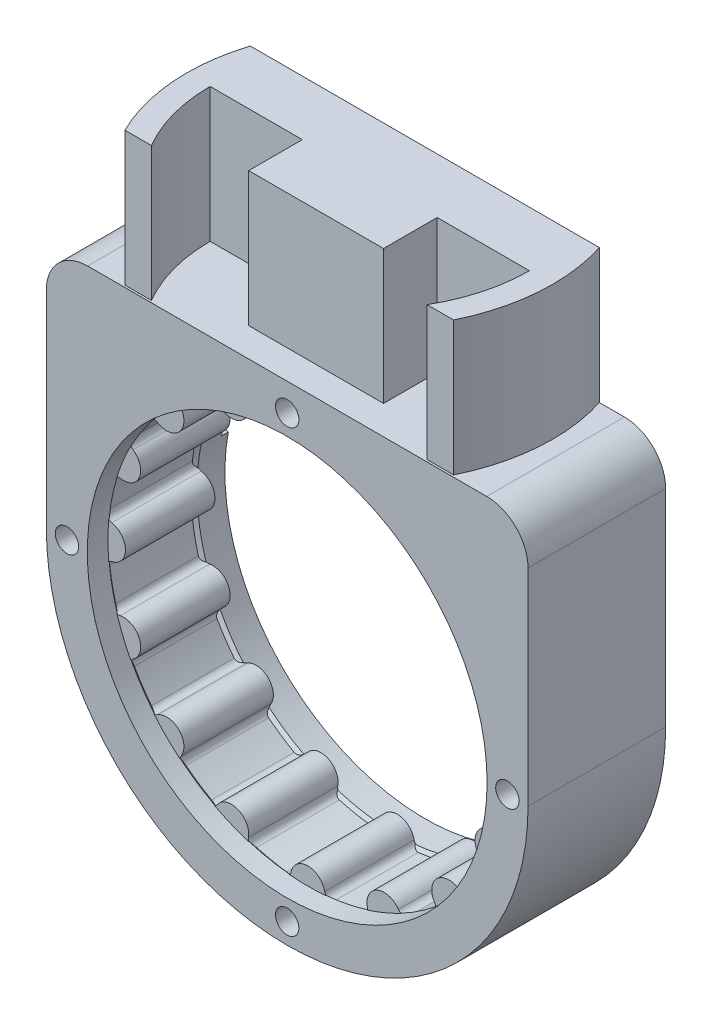
from build123d import *

# Parameters (mm, degrees)
EXTRUDE_START         = -19
EXTRUDE_2_OUTLINE_R   = 35
EXTRUDE_2_OUTLINE_R_2 = 1.7
EXTRUDE_2_DEPTH       = 20
EXTRUDE_START_2       = -16
EXTRUDE_2_2_DEPTH     = 13
EXTRUDE_START_3       = -3.0500001
EXTRUDE_2_3_DEPTH     = 4.0500001
EXTRUDE_2_4_DEPTH     = 3.049996921
EXTRUDE_2_5_DEPTH     = 3.0500001
EXTRUDE_START_4       = -20
SKETCH_8_R            = 1.7
EXTRUDE_3_DEPTH       = 20
EXTRUDE_4_DEPTH       = 19.5
FILLET_1_R            = 6
SKETCH_10_R           = 1.65
CUT_EXTRUDE_1_DEPTH   = 10


with BuildPart() as part:
    # 凸台-拉伸2: read off the stored shape, not the designer's step
    # 凸台-拉伸2 outline → 凸台-拉伸2 (new body)
    with BuildSketch(Plane(origin=(0, 0, -24), x_dir=(-1, 0, 0), z_dir=(0, 0, -1)).offset(EXTRUDE_START)):
        Circle(EXTRUDE_2_OUTLINE_R)
        with Locations((-16, -27.712812921)):
            Circle(EXTRUDE_2_OUTLINE_R_2, mode=Mode.SUBTRACT)
        with Locations((-27.712812921, -16)):
            Circle(EXTRUDE_2_OUTLINE_R_2, mode=Mode.SUBTRACT)
        with Locations((0, -32)):
            Circle(EXTRUDE_2_OUTLINE_R_2, mode=Mode.SUBTRACT)
        with Locations((16, -27.712812921)):
            Circle(EXTRUDE_2_OUTLINE_R_2, mode=Mode.SUBTRACT)
        with Locations((27.712812921, -16)):
            Circle(EXTRUDE_2_OUTLINE_R_2, mode=Mode.SUBTRACT)
        with Locations((-32, 0)):
            Circle(EXTRUDE_2_OUTLINE_R_2, mode=Mode.SUBTRACT)
        with Locations((-27.712812921, 16)):
            Circle(EXTRUDE_2_OUTLINE_R_2, mode=Mode.SUBTRACT)
        with BuildLine():
            ThreePointArc((29.28584392, 3.548146824), (29.221419292, 3.056078117), (28.928367046, 2.655575276))
            ThreePointArc((28.928367046, 2.655575276), (29.05, 0), (28.928367046, -2.655575276))
            ThreePointArc((28.928367046, -2.655575276), (29.221419292, -3.056078117), (29.28584392, -3.548146824))
            ThreePointArc((29.28584392, -3.548146824), (28.933165772, -5.7551645), (28.414408795, -7.929147042))
            ThreePointArc((28.414408795, -7.929147042), (28.166581658, -8.35910501), (27.742570884, -8.616975149))
            ThreePointArc((27.742570884, -8.616975149), (26.83870042, -11.11695371), (25.710081562, -13.523838438))
            ThreePointArc((25.710081562, -13.523838438), (25.827560731, -14.006001055), (25.698774785, -14.4852675))
            ThreePointArc((25.698774785, -14.4852675), (24.528353563, -16.389321874), (23.217137509, -18.199300149))
            ThreePointArc((23.217137509, -18.199300149), (22.823637298, -18.501690176), (22.333219792, -18.577669221))
            ThreePointArc((22.333219792, -18.577669221), (20.541451993, -20.541451993), (18.577669221, -22.333219792))
            ThreePointArc((18.577669221, -22.333219792), (18.501690176, -22.823637298), (18.199300149, -23.217137509))
            ThreePointArc((18.199300149, -23.217137509), (16.389321874, -24.528353563), (14.4852675, -25.698774785))
            ThreePointArc((14.4852675, -25.698774785), (14.006001055, -25.827560731), (13.523838438, -25.710081562))
            ThreePointArc((13.523838438, -25.710081562), (11.11695371, -26.83870042), (8.616975149, -27.742570884))
            ThreePointArc((8.616975149, -27.742570884), (8.35910501, -28.166581658), (7.929147042, -28.414408795))
            ThreePointArc((7.929147042, -28.414408795), (5.7551645, -28.933165772), (3.548146824, -29.28584392))
            ThreePointArc((3.548146824, -29.28584392), (3.056078117, -29.221419292), (2.655575276, -28.928367046))
            ThreePointArc((2.655575276, -28.928367046), (0, -29.05), (-2.655575276, -28.928367046))
            ThreePointArc((-2.655575276, -28.928367046), (-3.056078117, -29.221419292), (-3.548146824, -29.28584392))
            ThreePointArc((-3.548146824, -29.28584392), (-5.7551645, -28.933165772), (-7.929147042, -28.414408795))
            ThreePointArc((-7.929147042, -28.414408795), (-8.35910501, -28.166581658), (-8.616975149, -27.742570884))
            ThreePointArc((-8.616975149, -27.742570884), (-11.11695371, -26.83870042), (-13.523838438, -25.710081562))
            ThreePointArc((-13.523838438, -25.710081562), (-14.006001055, -25.827560731), (-14.4852675, -25.698774785))
            ThreePointArc((-14.4852675, -25.698774785), (-16.389321874, -24.528353563), (-18.199300149, -23.217137509))
            ThreePointArc((-18.199300149, -23.217137509), (-18.501690176, -22.823637298), (-18.577669221, -22.333219792))
            ThreePointArc((-18.577669221, -22.333219792), (-20.541451993, -20.541451993), (-22.333219792, -18.577669221))
            ThreePointArc((-22.333219792, -18.577669221), (-22.823637298, -18.501690176), (-23.217137509, -18.199300149))
            ThreePointArc((-23.217137509, -18.199300149), (-24.528353563, -16.389321874), (-25.698774785, -14.4852675))
            ThreePointArc((-25.698774785, -14.4852675), (-25.827560731, -14.006001055), (-25.710081562, -13.523838438))
            ThreePointArc((-25.710081562, -13.523838438), (-26.83870042, -11.11695371), (-27.742570884, -8.616975149))
            ThreePointArc((-27.742570884, -8.616975149), (-28.166581658, -8.35910501), (-28.414408795, -7.929147042))
            ThreePointArc((-28.414408795, -7.929147042), (-28.46389208, -7.749635323), (-28.512241289, -7.569814837))
            ThreePointArc((-28.512241289, -7.569814837), (-29.874875562, -6.387042362), (-29.114993387, -4.750490508))
            ThreePointArc((-29.114993387, -4.750490508), (-29.206606395, -4.150197931), (-29.28584392, -3.548146824))
            ThreePointArc((-29.28584392, -3.548146824), (-29.221419292, -3.056078117), (-28.928367046, -2.655575276))
            ThreePointArc((-28.928367046, -2.655575276), (-29.05, 0), (-28.928367046, 2.655575276))
            ThreePointArc((-28.928367046, 2.655575276), (-29.221419292, 3.056078117), (-29.28584392, 3.548146824))
            ThreePointArc((-29.28584392, 3.548146824), (-28.933165772, 5.7551645), (-28.414408795, 7.929147042))
            ThreePointArc((-28.414408795, 7.929147042), (-28.166581658, 8.35910501), (-27.742570884, 8.616975149))
            ThreePointArc((-27.742570884, 8.616975149), (-26.83870042, 11.11695371), (-25.710081562, 13.523838438))
            ThreePointArc((-25.710081562, 13.523838438), (-25.827560731, 14.006001055), (-25.698774785, 14.4852675))
            ThreePointArc((-25.698774785, 14.4852675), (-24.528353563, 16.389321874), (-23.217137509, 18.199300149))
            ThreePointArc((-23.217137509, 18.199300149), (-22.823637298, 18.501690176), (-22.333219792, 18.577669221))
            ThreePointArc((-22.333219792, 18.577669221), (-20.541451993, 20.541451993), (-18.577669221, 22.333219792))
            ThreePointArc((-18.577669221, 22.333219792), (-18.501690176, 22.823637298), (-18.199300149, 23.217137509))
            ThreePointArc((-18.199300149, 23.217137509), (-16.389321874, 24.528353563), (-14.4852675, 25.698774785))
            ThreePointArc((-14.4852675, 25.698774785), (-14.006001055, 25.827560731), (-13.523838438, 25.710081562))
            ThreePointArc((-13.523838438, 25.710081562), (-11.11695371, 26.83870042), (-8.616975149, 27.742570884))
            ThreePointArc((-8.616975149, 27.742570884), (-8.35910501, 28.166581658), (-7.929147042, 28.414408795))
            ThreePointArc((-7.929147042, 28.414408795), (-5.7551645, 28.933165772), (-3.548146824, 29.28584392))
            ThreePointArc((-3.548146824, 29.28584392), (-3.056078117, 29.221419292), (-2.655575276, 28.928367046))
            ThreePointArc((-2.655575276, 28.928367046), (0, 29.05), (2.655575276, 28.928367046))
            ThreePointArc((2.655575276, 28.928367046), (3.056078117, 29.221419292), (3.548146824, 29.28584392))
            ThreePointArc((3.548146824, 29.28584392), (5.7551645, 28.933165772), (7.929147042, 28.414408795))
            ThreePointArc((7.929147042, 28.414408795), (8.35910501, 28.166581658), (8.616975149, 27.742570884))
            ThreePointArc((8.616975149, 27.742570884), (11.11695371, 26.83870042), (13.523838438, 25.710081562))
            ThreePointArc((13.523838438, 25.710081562), (14.006001055, 25.827560731), (14.4852675, 25.698774785))
            ThreePointArc((14.4852675, 25.698774785), (16.389321874, 24.528353563), (18.199300149, 23.217137509))
            ThreePointArc((18.199300149, 23.217137509), (18.501690176, 22.823637298), (18.577669221, 22.333219792))
            ThreePointArc((18.577669221, 22.333219792), (20.541451993, 20.541451993), (22.333219792, 18.577669221))
            ThreePointArc((22.333219792, 18.577669221), (22.823637298, 18.501690176), (23.217137509, 18.199300149))
            ThreePointArc((23.217137509, 18.199300149), (24.528353563, 16.389321874), (25.698774785, 14.4852675))
            ThreePointArc((25.698774785, 14.4852675), (25.827560731, 14.006001055), (25.710081562, 13.523838438))
            ThreePointArc((25.710081562, 13.523838438), (26.83870042, 11.11695371), (27.742570884, 8.616975149))
            ThreePointArc((27.742570884, 8.616975149), (28.012796563, 8.487779368), (28.232640229, 8.28435314))
            ThreePointArc((28.232640229, 8.28435314), (29.695238585, 7.173826758), (28.986612137, 5.479627432))
            ThreePointArc((28.986612137, 5.479627432), (29.152228698, 4.516366008), (29.28584392, 3.548146824))
        make_face(mode=Mode.SUBTRACT)
        with Locations((-16, 27.712812921)):
            Circle(EXTRUDE_2_OUTLINE_R_2, mode=Mode.SUBTRACT)
        with Locations((32, 0)):
            Circle(EXTRUDE_2_OUTLINE_R_2, mode=Mode.SUBTRACT)
        with Locations((27.712812921, 16)):
            Circle(EXTRUDE_2_OUTLINE_R_2, mode=Mode.SUBTRACT)
        with Locations((0, 32)):
            Circle(EXTRUDE_2_OUTLINE_R_2, mode=Mode.SUBTRACT)
        with Locations((16, 27.712812921)):
            Circle(EXTRUDE_2_OUTLINE_R_2, mode=Mode.SUBTRACT)
    extrude(amount=EXTRUDE_2_DEPTH)

    # Extrude 2 2 outline → Extrude 2 2 (add)
    with BuildSketch(Plane(origin=(0, 0, -24), x_dir=(-1, 0, 0), z_dir=(0, 0, -1)).offset(EXTRUDE_START_2)):
        with BuildLine():
            ThreePointArc((28.928367046, -2.655575276), (29.05, 0), (28.928367046, 2.655575276))
            ThreePointArc((28.928367046, 2.655575276), (28.724337054, 2.52563035), (28.495073892, 2.448479043))
            ThreePointArc((28.495073892, 2.448479043), (26.5, 0), (28.495073892, -2.448479043))
            ThreePointArc((28.495073892, -2.448479043), (28.724337054, -2.52563035), (28.928367046, -2.655575276))
        make_face()
        with BuildLine():
            ThreePointArc((28.414408795, 7.929147042), (28.726631157, 6.710488983), (28.986612137, 5.479627432))
            ThreePointArc((28.986612137, 5.479627432), (29.695238585, 7.173826758), (28.232640229, 8.28435314))
            ThreePointArc((28.232640229, 8.28435314), (28.341420872, 8.115908143), (28.414408795, 7.929147042))
        make_face()
        with BuildLine():
            ThreePointArc((27.26300791, 8.642493009), (27.50434398, 8.658949709), (27.742570884, 8.616975149))
            ThreePointArc((27.742570884, 8.616975149), (26.83870042, 11.11695371), (25.710081562, 13.523838438))
            ThreePointArc((25.710081562, 13.523838438), (25.571310198, 13.325706083), (25.389023182, 13.166692356))
            ThreePointArc((25.389023182, 13.166692356), (24.482807612, 10.141110958), (27.26300791, 8.642493009))
        make_face()
        with BuildLine():
            ThreePointArc((21.880396114, 18.417723844), (22.097063863, 18.525283168), (22.333219792, 18.577669221))
            ThreePointArc((22.333219792, 18.577669221), (20.541451993, 20.541451993), (18.577669221, 22.333219792))
            ThreePointArc((18.577669221, 22.333219792), (18.525283168, 22.097063863), (18.417723844, 21.880396114))
            ThreePointArc((18.417723844, 21.880396114), (18.738329701, 18.738329701), (21.880396114, 18.417723844))
        make_face()
        with BuildLine():
            ThreePointArc((25.710081562, -13.523838438), (26.83870042, -11.11695371), (27.742570884, -8.616975149))
            ThreePointArc((27.742570884, -8.616975149), (27.50434398, -8.658949709), (27.26300791, -8.642493009))
            ThreePointArc((27.26300791, -8.642493009), (24.482807612, -10.141110958), (25.389023182, -13.166692356))
            ThreePointArc((25.389023182, -13.166692356), (25.571310198, -13.325706083), (25.710081562, -13.523838438))
        make_face()
        with BuildLine():
            ThreePointArc((13.166692356, 25.389023182), (13.325706083, 25.571310198), (13.523838438, 25.710081562))
            ThreePointArc((13.523838438, 25.710081562), (11.11695371, 26.83870042), (8.616975149, 27.742570884))
            ThreePointArc((8.616975149, 27.742570884), (8.658949709, 27.50434398), (8.642493009, 27.26300791))
            ThreePointArc((8.642493009, 27.26300791), (10.141110958, 24.482807612), (13.166692356, 25.389023182))
        make_face()
        with BuildLine():
            ThreePointArc((18.577669221, -22.333219792), (20.541451993, -20.541451993), (22.333219792, -18.577669221))
            ThreePointArc((22.333219792, -18.577669221), (22.097063863, -18.525283168), (21.880396114, -18.417723844))
            ThreePointArc((21.880396114, -18.417723844), (18.738329701, -18.738329701), (18.417723844, -21.880396114))
            ThreePointArc((18.417723844, -21.880396114), (18.525283168, -22.097063863), (18.577669221, -22.333219792))
        make_face()
        with BuildLine():
            ThreePointArc((2.448479043, 28.495073892), (2.52563035, 28.724337054), (2.655575276, 28.928367046))
            ThreePointArc((2.655575276, 28.928367046), (0, 29.05), (-2.655575276, 28.928367046))
            ThreePointArc((-2.655575276, 28.928367046), (-2.52563035, 28.724337054), (-2.448479043, 28.495073892))
            ThreePointArc((-2.448479043, 28.495073892), (0, 26.5), (2.448479043, 28.495073892))
        make_face()
        with BuildLine():
            ThreePointArc((8.616975149, -27.742570884), (11.11695371, -26.83870042), (13.523838438, -25.710081562))
            ThreePointArc((13.523838438, -25.710081562), (13.325706083, -25.571310198), (13.166692356, -25.389023182))
            ThreePointArc((13.166692356, -25.389023182), (10.141110958, -24.482807612), (8.642493009, -27.26300791))
            ThreePointArc((8.642493009, -27.26300791), (8.658949709, -27.50434398), (8.616975149, -27.742570884))
        make_face()
        with BuildLine():
            ThreePointArc((-8.642493009, 27.26300791), (-8.658949709, 27.50434398), (-8.616975149, 27.742570884))
            ThreePointArc((-8.616975149, 27.742570884), (-11.11695371, 26.83870042), (-13.523838438, 25.710081562))
            ThreePointArc((-13.523838438, 25.710081562), (-13.325706083, 25.571310198), (-13.166692356, 25.389023182))
            ThreePointArc((-13.166692356, 25.389023182), (-10.141110958, 24.482807612), (-8.642493009, 27.26300791))
        make_face()
        with BuildLine():
            ThreePointArc((-2.655575276, -28.928367046), (0, -29.05), (2.655575276, -28.928367046))
            ThreePointArc((2.655575276, -28.928367046), (2.52563035, -28.724337054), (2.448479043, -28.495073892))
            ThreePointArc((2.448479043, -28.495073892), (0, -26.5), (-2.448479043, -28.495073892))
            ThreePointArc((-2.448479043, -28.495073892), (-2.52563035, -28.724337054), (-2.655575276, -28.928367046))
        make_face()
        with BuildLine():
            ThreePointArc((-18.417723844, 21.880396114), (-18.525283168, 22.097063863), (-18.577669221, 22.333219792))
            ThreePointArc((-18.577669221, 22.333219792), (-20.541451993, 20.541451993), (-22.333219792, 18.577669221))
            ThreePointArc((-22.333219792, 18.577669221), (-22.097063863, 18.525283168), (-21.880396114, 18.417723844))
            ThreePointArc((-21.880396114, 18.417723844), (-18.738329701, 18.738329701), (-18.417723844, 21.880396114))
        make_face()
        with BuildLine():
            ThreePointArc((-13.523838438, -25.710081562), (-11.11695371, -26.83870042), (-8.616975149, -27.742570884))
            ThreePointArc((-8.616975149, -27.742570884), (-8.658949709, -27.50434398), (-8.642493009, -27.26300791))
            ThreePointArc((-8.642493009, -27.26300791), (-10.141110958, -24.482807612), (-13.166692356, -25.389023182))
            ThreePointArc((-13.166692356, -25.389023182), (-13.325706083, -25.571310198), (-13.523838438, -25.710081562))
        make_face()
        with BuildLine():
            ThreePointArc((-25.389023182, 13.166692356), (-25.571310198, 13.325706083), (-25.710081562, 13.523838438))
            ThreePointArc((-25.710081562, 13.523838438), (-26.83870042, 11.11695371), (-27.742570884, 8.616975149))
            ThreePointArc((-27.742570884, 8.616975149), (-27.50434398, 8.658949709), (-27.26300791, 8.642493009))
            ThreePointArc((-27.26300791, 8.642493009), (-24.482807612, 10.141110958), (-25.389023182, 13.166692356))
        make_face()
        with BuildLine():
            ThreePointArc((-22.333219792, -18.577669221), (-20.541451993, -20.541451993), (-18.577669221, -22.333219792))
            ThreePointArc((-18.577669221, -22.333219792), (-18.525283168, -22.097063863), (-18.417723844, -21.880396114))
            ThreePointArc((-18.417723844, -21.880396114), (-18.738329701, -18.738329701), (-21.880396114, -18.417723844))
            ThreePointArc((-21.880396114, -18.417723844), (-22.097063863, -18.525283168), (-22.333219792, -18.577669221))
        make_face()
        with BuildLine():
            ThreePointArc((-28.495073892, 2.448479043), (-28.724337054, 2.52563035), (-28.928367046, 2.655575276))
            ThreePointArc((-28.928367046, 2.655575276), (-29.05, 0), (-28.928367046, -2.655575276))
            ThreePointArc((-28.928367046, -2.655575276), (-28.724337054, -2.52563035), (-28.495073892, -2.448479043))
            ThreePointArc((-28.495073892, -2.448479043), (-26.5, 0), (-28.495073892, 2.448479043))
        make_face()
        with BuildLine():
            ThreePointArc((-27.742570884, -8.616975149), (-26.83870042, -11.11695371), (-25.710081562, -13.523838438))
            ThreePointArc((-25.710081562, -13.523838438), (-25.571310198, -13.325706083), (-25.389023182, -13.166692356))
            ThreePointArc((-25.389023182, -13.166692356), (-24.482807612, -10.141110958), (-27.26300791, -8.642493009))
            ThreePointArc((-27.26300791, -8.642493009), (-27.50434398, -8.658949709), (-27.742570884, -8.616975149))
        make_face()
        with BuildLine():
            ThreePointArc((-28.512241289, -7.569814837), (-28.848079512, -6.167520448), (-29.114993387, -4.750490508))
            ThreePointArc((-29.114993387, -4.750490508), (-29.874875562, -6.387042362), (-28.512241289, -7.569814837))
        make_face()
    extrude(amount=EXTRUDE_2_2_DEPTH)

    # Extrude 2 3 outline → Extrude 2 3 (add)
    with BuildSketch(Plane(origin=(0, 0, -24), x_dir=(-1, 0, 0), z_dir=(0, 0, -1)).offset(EXTRUDE_START_3)):
        with BuildLine():
            ThreePointArc((28.986612137, 5.479627432), (28.779129413, 5.382105224), (28.559208433, 5.317340849))
            ThreePointArc((28.559208433, 5.317340849), (28.774582232, 3.990728931), (28.928367046, 2.655575276))
            ThreePointArc((28.928367046, 2.655575276), (29.221419292, 3.056078117), (29.28584392, 3.548146824))
            ThreePointArc((29.28584392, 3.548146824), (29.152228698, 4.516366008), (28.986612137, 5.479627432))
        make_face()
        with BuildLine():
            ThreePointArc((27.742570884, 8.616975149), (27.801353712, 8.425392086), (27.858813533, 8.233408076))
            ThreePointArc((27.858813533, 8.233408076), (28.044118775, 8.270680628), (28.232640229, 8.28435314))
            ThreePointArc((28.232640229, 8.28435314), (28.012796563, 8.487779368), (27.742570884, 8.616975149))
        make_face()
        with BuildLine():
            ThreePointArc((22.333219792, 18.577669221), (24.154192237, 16.139315269), (25.710081562, 13.523838438))
            ThreePointArc((25.710081562, 13.523838438), (25.827560731, 14.006001055), (25.698774785, 14.4852675))
            ThreePointArc((25.698774785, 14.4852675), (24.528353563, 16.389321874), (23.217137509, 18.199300149))
            ThreePointArc((23.217137509, 18.199300149), (22.823637298, 18.501690176), (22.333219792, 18.577669221))
        make_face()
        with BuildLine():
            ThreePointArc((29.28584392, -3.548146824), (29.221419292, -3.056078117), (28.928367046, -2.655575276))
            ThreePointArc((28.928367046, -2.655575276), (28.491812396, -5.667373854), (27.742570884, -8.616975149))
            ThreePointArc((27.742570884, -8.616975149), (28.166581658, -8.35910501), (28.414408795, -7.929147042))
            ThreePointArc((28.414408795, -7.929147042), (28.933165772, -5.7551645), (29.28584392, -3.548146824))
        make_face()
        with BuildLine():
            ThreePointArc((13.523838438, 25.710081562), (16.139315269, 24.154192237), (18.577669221, 22.333219792))
            ThreePointArc((18.577669221, 22.333219792), (18.501690176, 22.823637298), (18.199300149, 23.217137509))
            ThreePointArc((18.199300149, 23.217137509), (16.389321874, 24.528353563), (14.4852675, 25.698774785))
            ThreePointArc((14.4852675, 25.698774785), (14.006001055, 25.827560731), (13.523838438, 25.710081562))
        make_face()
        with BuildLine():
            ThreePointArc((25.698774785, -14.4852675), (25.827560731, -14.006001055), (25.710081562, -13.523838438))
            ThreePointArc((25.710081562, -13.523838438), (24.154192237, -16.139315269), (22.333219792, -18.577669221))
            ThreePointArc((22.333219792, -18.577669221), (22.823637298, -18.501690176), (23.217137509, -18.199300149))
            ThreePointArc((23.217137509, -18.199300149), (24.528353563, -16.389321874), (25.698774785, -14.4852675))
        make_face()
        with BuildLine():
            ThreePointArc((2.655575276, 28.928367046), (5.667373854, 28.491812396), (8.616975149, 27.742570884))
            ThreePointArc((8.616975149, 27.742570884), (8.35910501, 28.166581658), (7.929147042, 28.414408795))
            ThreePointArc((7.929147042, 28.414408795), (5.7551645, 28.933165772), (3.548146824, 29.28584392))
            ThreePointArc((3.548146824, 29.28584392), (3.056078117, 29.221419292), (2.655575276, 28.928367046))
        make_face()
        with BuildLine():
            ThreePointArc((18.199300149, -23.217137509), (18.501690176, -22.823637298), (18.577669221, -22.333219792))
            ThreePointArc((18.577669221, -22.333219792), (16.139315269, -24.154192237), (13.523838438, -25.710081562))
            ThreePointArc((13.523838438, -25.710081562), (14.006001055, -25.827560731), (14.4852675, -25.698774785))
            ThreePointArc((14.4852675, -25.698774785), (16.389321874, -24.528353563), (18.199300149, -23.217137509))
        make_face()
        with BuildLine():
            ThreePointArc((-8.616975149, 27.742570884), (-5.667373854, 28.491812396), (-2.655575276, 28.928367046))
            ThreePointArc((-2.655575276, 28.928367046), (-3.056078117, 29.221419292), (-3.548146824, 29.28584392))
            ThreePointArc((-3.548146824, 29.28584392), (-5.7551645, 28.933165772), (-7.929147042, 28.414408795))
            ThreePointArc((-7.929147042, 28.414408795), (-8.35910501, 28.166581658), (-8.616975149, 27.742570884))
        make_face()
        with BuildLine():
            ThreePointArc((7.929147042, -28.414408795), (8.35910501, -28.166581658), (8.616975149, -27.742570884))
            ThreePointArc((8.616975149, -27.742570884), (5.667373854, -28.491812396), (2.655575276, -28.928367046))
            ThreePointArc((2.655575276, -28.928367046), (3.056078117, -29.221419292), (3.548146824, -29.28584392))
            ThreePointArc((3.548146824, -29.28584392), (5.7551645, -28.933165772), (7.929147042, -28.414408795))
        make_face()
        with BuildLine():
            ThreePointArc((-18.577669221, 22.333219792), (-16.139315269, 24.154192237), (-13.523838438, 25.710081562))
            ThreePointArc((-13.523838438, 25.710081562), (-14.006001055, 25.827560731), (-14.4852675, 25.698774785))
            ThreePointArc((-14.4852675, 25.698774785), (-16.389321874, 24.528353563), (-18.199300149, 23.217137509))
            ThreePointArc((-18.199300149, 23.217137509), (-18.501690176, 22.823637298), (-18.577669221, 22.333219792))
        make_face()
        with BuildLine():
            ThreePointArc((-3.548146824, -29.28584392), (-3.056078117, -29.221419292), (-2.655575276, -28.928367046))
            ThreePointArc((-2.655575276, -28.928367046), (-5.667373854, -28.491812396), (-8.616975149, -27.742570884))
            ThreePointArc((-8.616975149, -27.742570884), (-8.35910501, -28.166581658), (-7.929147042, -28.414408795))
            ThreePointArc((-7.929147042, -28.414408795), (-5.7551645, -28.933165772), (-3.548146824, -29.28584392))
        make_face()
        with BuildLine():
            ThreePointArc((-25.710081562, 13.523838438), (-24.154192237, 16.139315269), (-22.333219792, 18.577669221))
            ThreePointArc((-22.333219792, 18.577669221), (-22.823637298, 18.501690176), (-23.217137509, 18.199300149))
            ThreePointArc((-23.217137509, 18.199300149), (-24.528353563, 16.389321874), (-25.698774785, 14.4852675))
            ThreePointArc((-25.698774785, 14.4852675), (-25.827560731, 14.006001055), (-25.710081562, 13.523838438))
        make_face()
        with BuildLine():
            ThreePointArc((-14.4852675, -25.698774785), (-14.006001055, -25.827560731), (-13.523838438, -25.710081562))
            ThreePointArc((-13.523838438, -25.710081562), (-16.139315269, -24.154192237), (-18.577669221, -22.333219792))
            ThreePointArc((-18.577669221, -22.333219792), (-18.501690176, -22.823637298), (-18.199300149, -23.217137509))
            ThreePointArc((-18.199300149, -23.217137509), (-16.389321874, -24.528353563), (-14.4852675, -25.698774785))
        make_face()
        with BuildLine():
            ThreePointArc((-28.928367046, 2.655575276), (-28.491812396, 5.667373854), (-27.742570884, 8.616975149))
            ThreePointArc((-27.742570884, 8.616975149), (-28.166581658, 8.35910501), (-28.414408795, 7.929147042))
            ThreePointArc((-28.414408795, 7.929147042), (-28.933165772, 5.7551645), (-29.28584392, 3.548146824))
            ThreePointArc((-29.28584392, 3.548146824), (-29.221419292, 3.056078117), (-28.928367046, 2.655575276))
        make_face()
        with BuildLine():
            ThreePointArc((-23.217137509, -18.199300149), (-22.823637298, -18.501690176), (-22.333219792, -18.577669221))
            ThreePointArc((-22.333219792, -18.577669221), (-24.154192237, -16.139315269), (-25.710081562, -13.523838438))
            ThreePointArc((-25.710081562, -13.523838438), (-25.827560731, -14.006001055), (-25.698774785, -14.4852675))
            ThreePointArc((-25.698774785, -14.4852675), (-24.528353563, -16.389321874), (-23.217137509, -18.199300149))
        make_face()
        with BuildLine():
            ThreePointArc((-28.683651743, -4.598980614), (-28.822393782, -3.629341081), (-28.928367046, -2.655575276))
            ThreePointArc((-28.928367046, -2.655575276), (-29.221419292, -3.056078117), (-29.28584392, -3.548146824))
            ThreePointArc((-29.28584392, -3.548146824), (-29.206606395, -4.150197931), (-29.114993387, -4.750490508))
            ThreePointArc((-29.114993387, -4.750490508), (-28.90512871, -4.658205735), (-28.683651743, -4.598980614))
        make_face()
        with BuildLine():
            ThreePointArc((-28.414408795, -7.929147042), (-28.166581658, -8.35910501), (-27.742570884, -8.616975149))
            ThreePointArc((-27.742570884, -8.616975149), (-27.904889611, -8.075867494), (-28.056655339, -7.531705728))
            ThreePointArc((-28.056655339, -7.531705728), (-28.282987901, -7.568219196), (-28.512241289, -7.569814837))
            ThreePointArc((-28.512241289, -7.569814837), (-28.46389208, -7.749635323), (-28.414408795, -7.929147042))
        make_face()
    extrude(amount=EXTRUDE_2_3_DEPTH)

    # Extrude 2 4 outline → Extrude 2 4 (add)
    with BuildSketch(Plane(origin=(0, 0, -24), x_dir=(-1, 0, 0), z_dir=(0, 0, -1)).offset(EXTRUDE_START)):
        with BuildLine():
            ThreePointArc((29.28584392, 3.548146824), (29.152228698, 4.516366008), (28.986612137, 5.479627432))
            ThreePointArc((28.986612137, 5.479627432), (29.695238585, 7.173826758), (28.232640229, 8.28435314))
            ThreePointArc((28.232640229, 8.28435314), (28.012796563, 8.487779368), (27.742570884, 8.616975149))
            ThreePointArc((27.742570884, 8.616975149), (28.491812396, 5.667373854), (28.928367046, 2.655575276))
            ThreePointArc((28.928367046, 2.655575276), (29.221419292, 3.056078117), (29.28584392, 3.548146824))
        make_face()
        with BuildLine():
            ThreePointArc((22.333219792, 18.577669221), (24.154192237, 16.139315269), (25.710081562, 13.523838438))
            ThreePointArc((25.710081562, 13.523838438), (25.827560731, 14.006001055), (25.698774785, 14.4852675))
            ThreePointArc((25.698774785, 14.4852675), (24.528353563, 16.389321874), (23.217137509, 18.199300149))
            ThreePointArc((23.217137509, 18.199300149), (22.823637298, 18.501690176), (22.333219792, 18.577669221))
        make_face()
        with BuildLine():
            ThreePointArc((29.28584392, -3.548146824), (29.221419292, -3.056078117), (28.928367046, -2.655575276))
            ThreePointArc((28.928367046, -2.655575276), (28.491812396, -5.667373854), (27.742570884, -8.616975149))
            ThreePointArc((27.742570884, -8.616975149), (28.166581658, -8.35910501), (28.414408795, -7.929147042))
            ThreePointArc((28.414408795, -7.929147042), (28.933165772, -5.7551645), (29.28584392, -3.548146824))
        make_face()
        with BuildLine():
            ThreePointArc((13.523838438, 25.710081562), (16.139315269, 24.154192237), (18.577669221, 22.333219792))
            ThreePointArc((18.577669221, 22.333219792), (18.501690176, 22.823637298), (18.199300149, 23.217137509))
            ThreePointArc((18.199300149, 23.217137509), (16.389321874, 24.528353563), (14.4852675, 25.698774785))
            ThreePointArc((14.4852675, 25.698774785), (14.006001055, 25.827560731), (13.523838438, 25.710081562))
        make_face()
        with BuildLine():
            ThreePointArc((25.698774785, -14.4852675), (25.827560731, -14.006001055), (25.710081562, -13.523838438))
            ThreePointArc((25.710081562, -13.523838438), (24.154192237, -16.139315269), (22.333219792, -18.577669221))
            ThreePointArc((22.333219792, -18.577669221), (22.823637298, -18.501690176), (23.217137509, -18.199300149))
            ThreePointArc((23.217137509, -18.199300149), (24.528353563, -16.389321874), (25.698774785, -14.4852675))
        make_face()
        with BuildLine():
            ThreePointArc((2.655575276, 28.928367046), (5.667373854, 28.491812396), (8.616975149, 27.742570884))
            ThreePointArc((8.616975149, 27.742570884), (8.35910501, 28.166581658), (7.929147042, 28.414408795))
            ThreePointArc((7.929147042, 28.414408795), (5.7551645, 28.933165772), (3.548146824, 29.28584392))
            ThreePointArc((3.548146824, 29.28584392), (3.056078117, 29.221419292), (2.655575276, 28.928367046))
        make_face()
        with BuildLine():
            ThreePointArc((18.199300149, -23.217137509), (18.501690176, -22.823637298), (18.577669221, -22.333219792))
            ThreePointArc((18.577669221, -22.333219792), (16.139315269, -24.154192237), (13.523838438, -25.710081562))
            ThreePointArc((13.523838438, -25.710081562), (14.006001055, -25.827560731), (14.4852675, -25.698774785))
            ThreePointArc((14.4852675, -25.698774785), (16.389321874, -24.528353563), (18.199300149, -23.217137509))
        make_face()
        with BuildLine():
            ThreePointArc((-8.616975149, 27.742570884), (-5.667373854, 28.491812396), (-2.655575276, 28.928367046))
            ThreePointArc((-2.655575276, 28.928367046), (-3.056078117, 29.221419292), (-3.548146824, 29.28584392))
            ThreePointArc((-3.548146824, 29.28584392), (-5.7551645, 28.933165772), (-7.929147042, 28.414408795))
            ThreePointArc((-7.929147042, 28.414408795), (-8.35910501, 28.166581658), (-8.616975149, 27.742570884))
        make_face()
        with BuildLine():
            ThreePointArc((7.929147042, -28.414408795), (8.35910501, -28.166581658), (8.616975149, -27.742570884))
            ThreePointArc((8.616975149, -27.742570884), (5.667373854, -28.491812396), (2.655575276, -28.928367046))
            ThreePointArc((2.655575276, -28.928367046), (3.056078117, -29.221419292), (3.548146824, -29.28584392))
            ThreePointArc((3.548146824, -29.28584392), (5.7551645, -28.933165772), (7.929147042, -28.414408795))
        make_face()
        with BuildLine():
            ThreePointArc((-18.577669221, 22.333219792), (-16.139315269, 24.154192237), (-13.523838438, 25.710081562))
            ThreePointArc((-13.523838438, 25.710081562), (-14.006001055, 25.827560731), (-14.4852675, 25.698774785))
            ThreePointArc((-14.4852675, 25.698774785), (-16.389321874, 24.528353563), (-18.199300149, 23.217137509))
            ThreePointArc((-18.199300149, 23.217137509), (-18.501690176, 22.823637298), (-18.577669221, 22.333219792))
        make_face()
        with BuildLine():
            ThreePointArc((-3.548146824, -29.28584392), (-3.056078117, -29.221419292), (-2.655575276, -28.928367046))
            ThreePointArc((-2.655575276, -28.928367046), (-5.667373854, -28.491812396), (-8.616975149, -27.742570884))
            ThreePointArc((-8.616975149, -27.742570884), (-8.35910501, -28.166581658), (-7.929147042, -28.414408795))
            ThreePointArc((-7.929147042, -28.414408795), (-5.7551645, -28.933165772), (-3.548146824, -29.28584392))
        make_face()
        with BuildLine():
            ThreePointArc((-25.710081562, 13.523838438), (-24.154192237, 16.139315269), (-22.333219792, 18.577669221))
            ThreePointArc((-22.333219792, 18.577669221), (-22.823637298, 18.501690176), (-23.217137509, 18.199300149))
            ThreePointArc((-23.217137509, 18.199300149), (-24.528353563, 16.389321874), (-25.698774785, 14.4852675))
            ThreePointArc((-25.698774785, 14.4852675), (-25.827560731, 14.006001055), (-25.710081562, 13.523838438))
        make_face()
        with BuildLine():
            ThreePointArc((-14.4852675, -25.698774785), (-14.006001055, -25.827560731), (-13.523838438, -25.710081562))
            ThreePointArc((-13.523838438, -25.710081562), (-16.139315269, -24.154192237), (-18.577669221, -22.333219792))
            ThreePointArc((-18.577669221, -22.333219792), (-18.501690176, -22.823637298), (-18.199300149, -23.217137509))
            ThreePointArc((-18.199300149, -23.217137509), (-16.389321874, -24.528353563), (-14.4852675, -25.698774785))
        make_face()
        with BuildLine():
            ThreePointArc((-28.928367046, 2.655575276), (-28.491812396, 5.667373854), (-27.742570884, 8.616975149))
            ThreePointArc((-27.742570884, 8.616975149), (-28.166581658, 8.35910501), (-28.414408795, 7.929147042))
            ThreePointArc((-28.414408795, 7.929147042), (-28.933165772, 5.7551645), (-29.28584392, 3.548146824))
            ThreePointArc((-29.28584392, 3.548146824), (-29.221419292, 3.056078117), (-28.928367046, 2.655575276))
        make_face()
        with BuildLine():
            ThreePointArc((-23.217137509, -18.199300149), (-22.823637298, -18.501690176), (-22.333219792, -18.577669221))
            ThreePointArc((-22.333219792, -18.577669221), (-24.154192237, -16.139315269), (-25.710081562, -13.523838438))
            ThreePointArc((-25.710081562, -13.523838438), (-25.827560731, -14.006001055), (-25.698774785, -14.4852675))
            ThreePointArc((-25.698774785, -14.4852675), (-24.528353563, -16.389321874), (-23.217137509, -18.199300149))
        make_face()
        with BuildLine():
            ThreePointArc((-28.928367046, -2.655575276), (-29.221419292, -3.056078117), (-29.28584392, -3.548146824))
            ThreePointArc((-29.28584392, -3.548146824), (-29.206606395, -4.150197931), (-29.114993387, -4.750490508))
            ThreePointArc((-29.114993387, -4.750490508), (-29.874875562, -6.387042362), (-28.512241289, -7.569814837))
            ThreePointArc((-28.512241289, -7.569814837), (-28.46389208, -7.749635323), (-28.414408795, -7.929147042))
            ThreePointArc((-28.414408795, -7.929147042), (-28.166581658, -8.35910501), (-27.742570884, -8.616975149))
            ThreePointArc((-27.742570884, -8.616975149), (-28.491812396, -5.667373854), (-28.928367046, -2.655575276))
        make_face()
    extrude(amount=EXTRUDE_2_4_DEPTH)

    # Extrude 2 5 outline → Extrude 2 5 (add)
    with BuildSketch(Plane(origin=(0, 0, -24), x_dir=(-1, 0, 0), z_dir=(0, 0, -1)).offset(EXTRUDE_START_3)):
        with BuildLine():
            ThreePointArc((27.858813533, 8.233408076), (28.246666399, 6.784418719), (28.559208433, 5.317340849))
            ThreePointArc((28.559208433, 5.317340849), (29.705186178, 7.134732939), (27.858813533, 8.233408076))
        make_face()
        with BuildLine():
            ThreePointArc((-28.056655339, -7.531705728), (-28.408024062, -6.073439627), (-28.683651743, -4.598980614))
            ThreePointArc((-28.683651743, -4.598980614), (-29.874875562, -6.387042362), (-28.056655339, -7.531705728))
        make_face()
    extrude(amount=EXTRUDE_2_5_DEPTH)

    # Extrude 2 6 outline → Extrude 2 6 (revolve)
    with BuildSketch(Plane.XZ):
        Polygon((29.5, -8.049996921), (29.05, -8.049996921), (29.50000105, -8.50000105), align=None)
        Polygon((29.50000105, -20.950005662), (29.50000105, -20.49999895), (29.049994338, -20.950005662), align=None)
    revolve(axis=Axis((0, 0, 0), (0, 0, 1)))

    # 草图8 → 凸台-拉伸3 (add)
    with BuildSketch(Plane(origin=(0, 0, -25), x_dir=(-1, 0, 0), z_dir=(0, 0, -1)).offset(EXTRUDE_START_4)):
        with Locations((-27.712812921, -16)):
            Circle(SKETCH_8_R)
        with Locations((-16, -27.712812921)):
            Circle(SKETCH_8_R)
        with Locations((-27.712812921, 16)):
            Circle(SKETCH_8_R)
        with Locations((-16, 27.712812921)):
            Circle(SKETCH_8_R)
        with Locations((16, 27.712812921)):
            Circle(SKETCH_8_R)
        with Locations((27.712812921, 16)):
            Circle(SKETCH_8_R)
        with Locations((27.712812921, -16)):
            Circle(SKETCH_8_R)
        with Locations((16, -27.712812921)):
            Circle(SKETCH_8_R)
        with BuildLine():
            Line((-35, 0), (-35, 36))
            Line((-35, 36), (35, 36))
            Line((35, 36), (35, 0))
            ThreePointArc((35, 0), (0, 35), (-35, 0))
        make_face()
    extrude(amount=EXTRUDE_3_DEPTH)

    # 草图9 → 凸台-拉伸4 (add)
    with BuildSketch(Plane(origin=(0, 36, 0), x_dir=(1, 0, 0), z_dir=(0, 1, 0))):
        with BuildLine():
            Line((0, 25), (-25.368484385, 25))
            ThreePointArc((-25.368484385, 25), (-26.52515921, 15.006026864), (-23.887374858, 5.297294228))
            Line((-23.887374858, 5.297294228), (-23.738050766, 5.297294228))
            Line((-23.738050766, 5.297294228), (-20.032141114, 5.297294228))
            ThreePointArc((-20.032141114, 5.297294228), (-22.394035744, 10.938056163), (-23.2, 17))
            Line((-23.2, 17), (-9.8, 17))
            Line((-9.8, 17), (-9.8, 9.2))
            Line((-9.8, 9.2), (9.8, 9.2))
            Line((9.8, 9.2), (9.8, 17))
            Line((9.8, 17), (23.2, 17))
            ThreePointArc((23.2, 17), (22.394035744, 10.938056163), (20.032141114, 5.297294228))
            Line((20.032141114, 5.297294228), (23.887374858, 5.297294228))
            ThreePointArc((23.887374858, 5.297294228), (26.52515921, 15.006026864), (25.368484385, 25))
            Line((25.368484385, 25), (0, 25))
        make_face()
    extrude(amount=EXTRUDE_4_DEPTH)

    # 圆角1
    fillet_1_edges = [part.edges().sort_by_distance(p)[0] for p in [
        (35, 36, -15),
        (-35, 36, -15),
    ]]
    fillet(fillet_1_edges, radius=FILLET_1_R)

    # 草图10 → 切除-拉伸1 (cut)
    with BuildSketch(Plane(origin=(0, 0, -25), x_dir=(-1, 0, 0), z_dir=(0, 0, -1))):
        with Locations((15, 45.7)):
            Circle(SKETCH_10_R)
        with Locations((-15, 45.7)):
            Circle(SKETCH_10_R)
    extrude(amount=-CUT_EXTRUDE_1_DEPTH, mode=Mode.SUBTRACT)


solid = part.part
